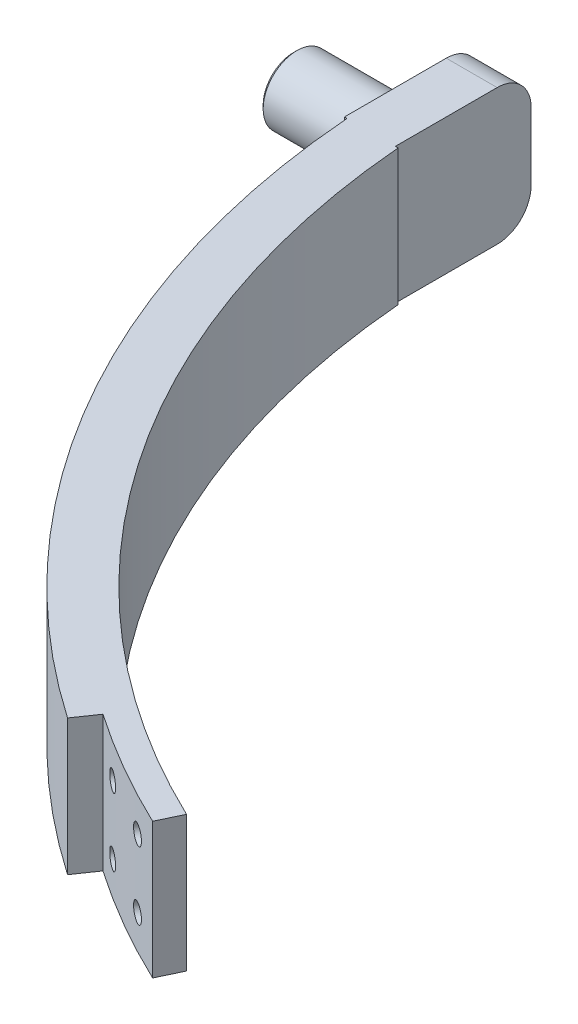
from build123d import *

# Parameters (mm, degrees)
BOSS_EXTRUDE4_DEPTH          = 40
SKETCH18_R                   = 12.5
BOSS_EXTRUDE2_DEPTH          = 5
SKETCH19_R                   = 9.95
BOSS_EXTRUDE3_DEPTH          = 30
FILLET1_R                    = 10
M5_START                     = -139.716402581
M5_CLEARANCE_HOLE2_OUTLINE_R = 2.75
M5_CLEARANCE_HOLE2_DEPTH     = 7.727879289
CHAMFER1_SIZE                = 1


# Read off the part's stored shape, not the designer's step: M5 Clearance Hole2
with BuildPart() as part:
    # Sketch20 → Boss-Extrude4 (new body)
    with BuildSketch(Plane(origin=(0, 0, 0), x_dir=(1, 0, 0), z_dir=(0, 1, 0))):
        with BuildLine():
            Line((112.573466187, -234.162128136), (116.826154662, -227.98437444))
            ThreePointArc((116.826154662, -227.98437444), (133.75, -238.671414456), (151.467170814, -247.98437444))
            Line((151.467170814, -247.98437444), (154.690918215, -241.212561338))
            ThreePointArc((154.690918215, -241.212561338), (58.362499128, -159.166512646), (15.817691059, -40))
            Line((15.817691059, -40), (15, -40))
            Line((15, -40), (15, -20))
            Line((15, -20), (15, 0))
            Line((15, 0), (0, 0))
            Line((0, 0), (0, -20))
            Line((0, -20), (0, -40))
            Line((0, -40), (0.770372064, -40))
            ThreePointArc((0.770372064, -40), (34.68457338, -149.741891952), (112.573466187, -234.162128136))
        make_face()
    extrude(amount=BOSS_EXTRUDE4_DEPTH)

    # Sketch18 → Boss-Extrude2 (add)
    with BuildSketch(Plane.ZY):
        with Locations((20, 20)):
            Circle(SKETCH18_R)
    extrude(amount=BOSS_EXTRUDE2_DEPTH)

    # Sketch19 → Boss-Extrude3 (add)
    with BuildSketch(Plane.ZY.offset(5)):
        with Locations((20, 20)):
            Circle(SKETCH19_R)
    extrude(amount=BOSS_EXTRUDE3_DEPTH)

    # Fillet1
    fillet1_edges = [part.edges().sort_by_distance(p)[0] for p in [
        (7.5, 0, 0),
        (7.5, 40, 0),
    ]]
    fillet(fillet1_edges, radius=FILLET1_R)

    # M5 Clearance Hole2 outline → M5 Clearance Hole2 (cut)
    with BuildSketch(Plane(origin=(0, 0, 0), x_dir=(0.8660254037844398, 0, 0.499999999999998), z_dir=(0.49999999999999795, 0, -0.8660254037844399)).offset(M5_START)):
        with Locations((245.166604984, -30)):
            Circle(M5_CLEARANCE_HOLE2_OUTLINE_R)
        with Locations((225.166604984, -10)):
            Circle(M5_CLEARANCE_HOLE2_OUTLINE_R)
        with Locations((225.166604984, -30)):
            Circle(M5_CLEARANCE_HOLE2_OUTLINE_R)
        with Locations((245.166604984, -10)):
            Circle(M5_CLEARANCE_HOLE2_OUTLINE_R)
    extrude(amount=M5_CLEARANCE_HOLE2_DEPTH, mode=Mode.SUBTRACT)

    # Chamfer1
    chamfer1_edges = [part.edges().sort_by_distance(p)[0] for p in [
        (-35, 20, 10.05),
    ]]
    chamfer(chamfer1_edges, length=CHAMFER1_SIZE)


solid = part.part
